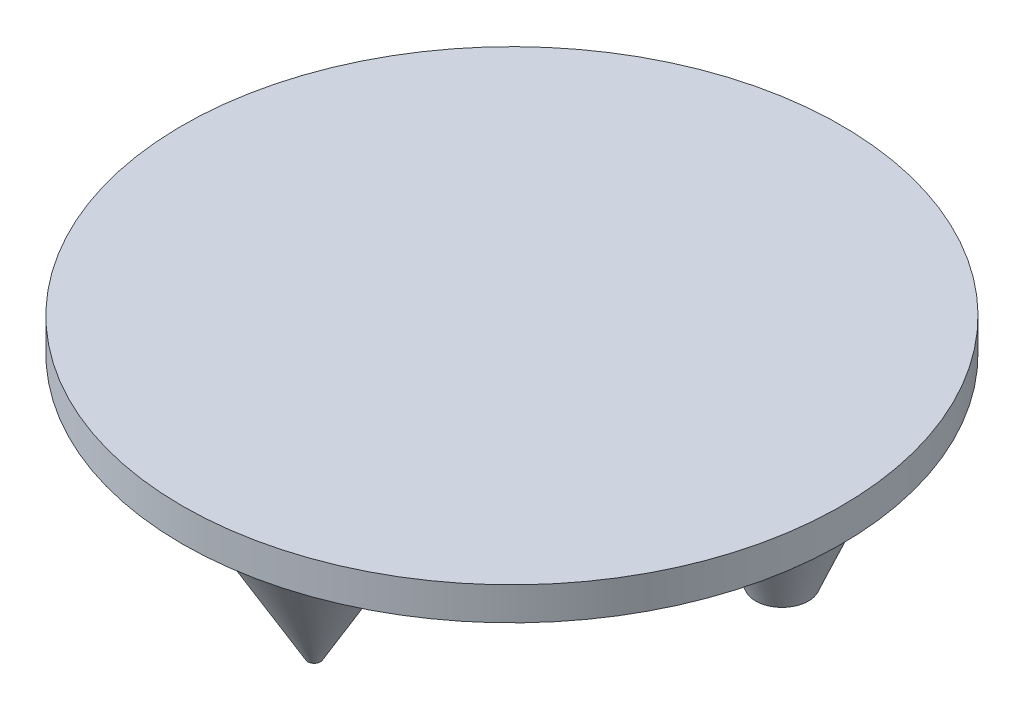
from build123d import *

# Parameters (mm, degrees)
SKETCH2_R           = 12.7
BOSS_EXTRUDE1_DEPTH = 1.27
SKETCH3_R           = 3.175
BOSS_EXTRUDE2_DEPTH = 6.35
CIRPATTERN1_COUNT   = 3
CHAMFER1_SIZE       = 5.08
CHAMFER1_SIZE2      = 2.932939367
CHAMFER2_SIZE       = 5.08
CHAMFER2_SIZE2      = 2.156332066
CHAMFER3_SIZE       = 5.08
CHAMFER3_SIZE2      = 1.45666656
FILLET1_R           = 2.54


with BuildPart() as part:
    # Sketch2 → Boss-Extrude1 (new body)
    with BuildSketch(Plane(origin=(0, 0, 0), x_dir=(1, 0, 0), z_dir=(0, 1, 0))):
        Circle(SKETCH2_R)
    extrude(amount=BOSS_EXTRUDE1_DEPTH)

    # Sketch3 → Boss-Extrude2 (add)
    with BuildSketch(Plane.XZ):
        with Locations((0, 7.62)):
            Circle(SKETCH3_R)
    boss_extrude2 = extrude(amount=BOSS_EXTRUDE2_DEPTH)

    # CirPattern1: Boss-Extrude2 ×3 about axis
    cirpattern1_axis = Axis((0, 1.27, 0), (0, -1, 0))
    for i in range(1, CIRPATTERN1_COUNT):
        add(boss_extrude2.rotate(cirpattern1_axis, i * 360 / CIRPATTERN1_COUNT))

    # Chamfer1
    chamfer1_edges = [part.edges().sort_by_distance(p)[0] for p in [
        (-3.175, -6.35, 7.62),
    ]]
    chamfer1_side = [part.faces().sort_by_distance(p)[0] for p in [
        (-3.175, -3.175, 7.62),
    ]]
    chamfer(chamfer1_edges, length=CHAMFER1_SIZE, length2=CHAMFER1_SIZE2, reference=chamfer1_side[0])

    # Chamfer2
    chamfer2_edges = [part.edges().sort_by_distance(p)[0] for p in [
        (8.186613577, -6.35, -1.060369343),
    ]]
    chamfer2_side = [part.faces().sort_by_distance(p)[0] for p in [
        (8.186613577, -3.175, -1.060369343),
    ]]
    chamfer(chamfer2_edges, length=CHAMFER2_SIZE, length2=CHAMFER2_SIZE2, reference=chamfer2_side[0])

    # Chamfer3
    chamfer3_edges = [part.edges().sort_by_distance(p)[0] for p in [
        (-5.011613577, -6.35, -6.559630657),
    ]]
    chamfer3_side = [part.faces().sort_by_distance(p)[0] for p in [
        (-5.011613577, -3.175, -6.559630657),
    ]]
    chamfer(chamfer3_edges, length=CHAMFER3_SIZE, length2=CHAMFER3_SIZE2, reference=chamfer3_side[0])

    # Fillet1
    fillet1_edges = [part.edges().sort_by_distance(p)[0] for p in [
        (8.186613577, -1.27, -1.060369343),
        (-3.175, -1.27, 7.62),
        (-5.011613577, -1.27, -6.559630657),
    ]]
    fillet(fillet1_edges, radius=FILLET1_R)


solid = part.part
